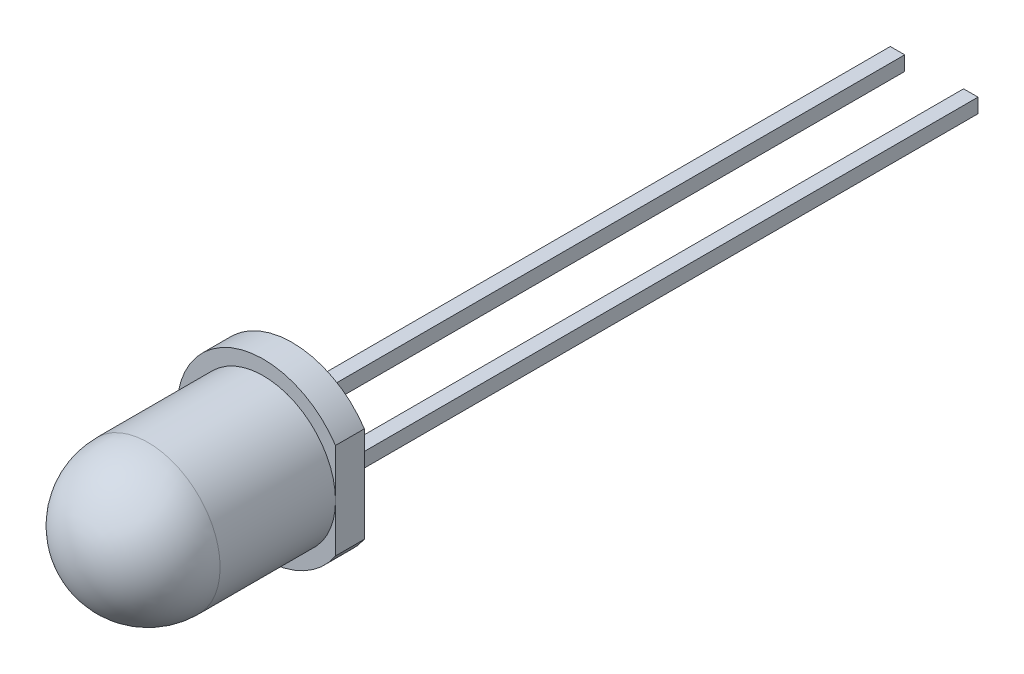
from build123d import *

# Parameters (mm, degrees)
SKETCH1_R           = 3
BOSS_EXTRUDE1_DEPTH = 1
SKETCH2_R           = 2.5
BOSS_EXTRUDE2_DEPTH = 4
DOME1_FACE_RADIUS   = 2.5
DOME1_HEIGHT        = 2.5
CUT_EXTRUDE1_REACH  = 9.762
SKETCH3_W           = 0.5
SKETCH3_H           = 4.031292186
SKETCH8_W           = 0.5
SKETCH8_H           = 22
BASE_FLANGE1_DEPTH  = 0.25
SKETCH9_W           = 0.5
SKETCH9_H           = 22
BASE_FLANGE2_DEPTH  = 0.25


# Sheet-metal steps are written as plain solids
with BuildPart() as part:
    # Sketch1 → Boss-Extrude1 (new body)
    with BuildSketch(Plane.XY):
        Circle(SKETCH1_R)
    extrude(amount=BOSS_EXTRUDE1_DEPTH)

    # Sketch2 → Boss-Extrude2 (add)
    with BuildSketch(Plane.XY.offset(1)):
        Circle(SKETCH2_R)
    extrude(amount=BOSS_EXTRUDE2_DEPTH)

    # Dome1: a dome of height H over a round flat face of radius A is a cap of a sphere of radius (A * A + H * H) / (2 * H)
    dome1_r = (DOME1_FACE_RADIUS * DOME1_FACE_RADIUS + DOME1_HEIGHT * DOME1_HEIGHT) / (2 * DOME1_HEIGHT)
    dome1_base = Plane((0, 0, 5), z_dir=(0, 0, 1))
    with Locations(dome1_base.offset(DOME1_HEIGHT - dome1_r)):
        dome1_ball = Sphere(dome1_r, mode=Mode.PRIVATE)
    add(split(dome1_ball, bisect_by=dome1_base, keep=Keep.TOP, mode=Mode.PRIVATE))

    # Sketch3 → Cut-Extrude1 (cut, up to next)
    with BuildSketch(Plane.XY.offset(1), mode=Mode.PRIVATE) as cut_extrude1_sk1:
        with Locations((2.75, -0.165370345)):
            Rectangle(SKETCH3_W, SKETCH3_H)
    cut_extrude1_tool1 = extrude(cut_extrude1_sk1.sketch, amount=-CUT_EXTRUDE1_REACH, mode=Mode.PRIVATE) & part.part
    add(cut_extrude1_tool1.solids().sort_by_distance((2.75, -0.16537, 1))[0], mode=Mode.SUBTRACT)


with BuildPart() as body_2:
    # Sketch8 → Base-Flange1 (new, symmetric)
    with BuildSketch(Plane(origin=(0, 0, 0), x_dir=(1, 0, 0), z_dir=(0, 1, 0))):
        with Locations((-1.02, 11)):
            Rectangle(SKETCH8_W, SKETCH8_H)
    extrude(amount=BASE_FLANGE1_DEPTH, both=True)


with BuildPart() as body_3:
    # Sketch9 → Base-Flange2 (new, symmetric)
    with BuildSketch(Plane(origin=(0, 0, 0), x_dir=(1, 0, 0), z_dir=(0, 1, 0))):
        with Locations((1.52, 11)):
            Rectangle(SKETCH9_W, SKETCH9_H)
    extrude(amount=BASE_FLANGE2_DEPTH, both=True)


solid = Compound([part.part, body_2.part, body_3.part])
